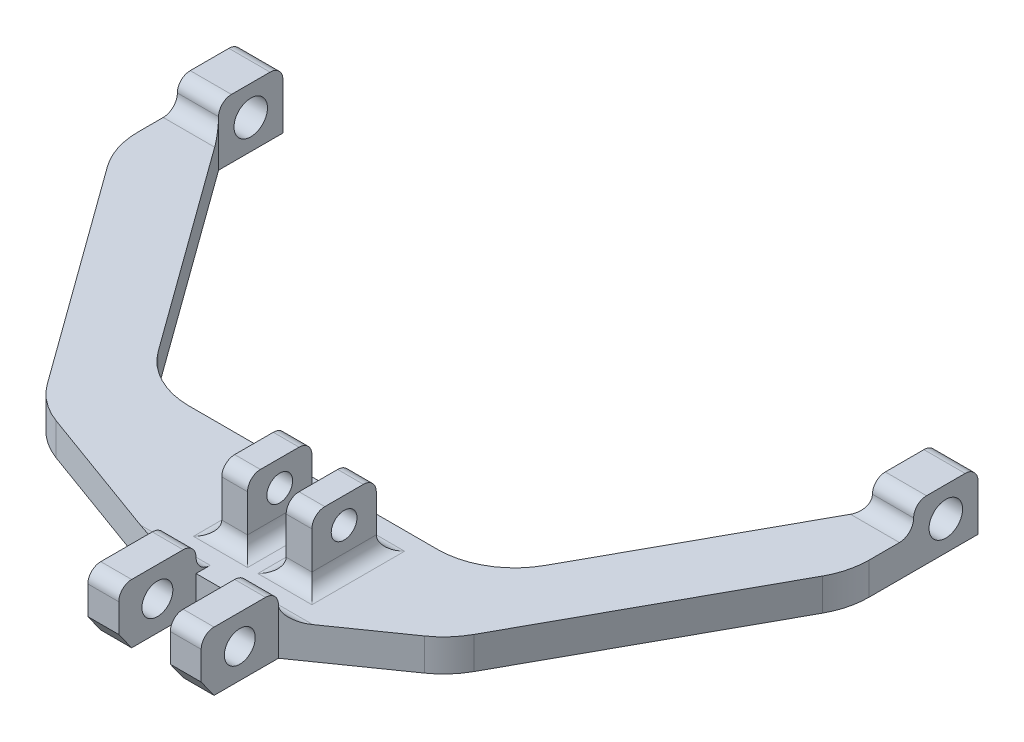
from build123d import *

# Parameters (mm, degrees)
BOSS_EXTRUDE1_DEPTH = 12.5
SKETCH5_W           = 10
SKETCH5_H           = 25
BOSS_EXTRUDE2_DEPTH = 25
SKETCH7_W           = 12
SKETCH7_H           = 30
BOSS_EXTRUDE4_DEPTH = 10.5
SKETCH8_R           = 6
CUT_EXTRUDE1_DEPTH  = 258.475083954
SKETCH11_W          = 16
SKETCH11_H          = 25
BOSS_EXTRUDE6_DEPTH = 10.5
SKETCH12_R          = 6.5
CUT_EXTRUDE3_DEPTH  = 356.26387941
SKETCH13_R          = 5
CUT_EXTRUDE4_DEPTH  = 261.08353454
FILLET2_R           = 30
FILLET3_R           = 5
FILLET4_R           = 5.5
CHAMFER1_SIZE       = 5
CHAMFER1_SIZE2      = 7


with BuildPart() as part:
    # Sketch2 → Boss-Extrude1 (new body)
    with BuildSketch(Plane(origin=(0, 0, 0), x_dir=(1, 0, 0), z_dir=(0, 1, 0))):
        Polygon((72.577488302, -150.138388534), (147.752897965, -177.5), (147.752897965, -207.5), (159.752897965, -207.5), (159.752897965, -177.5), (169.752897965, -177.5), (179.752897965, -177.5), (179.752897965, -207.5), (191.752897965, -207.5), (191.752897965, -177.5), (230.829328841, -150.138388534), (285.919436229, -50), (285.919436229, 0), (269.919436229, 0), (269.919436229, -25), (216.280811233, -122.5), (86.665258479, -122.5), (16, -25), (16, 0), (0, 0), (0, -50), align=None)
    extrude(amount=BOSS_EXTRUDE1_DEPTH)

    # Sketch5 → Boss-Extrude2 (add)
    with BuildSketch(Plane(origin=(0, 12.5, 0), x_dir=(1, 0, 0), z_dir=(0, 1, 0))):
        with Locations((157.252897965, -147.5)):
            Rectangle(SKETCH5_W, SKETCH5_H)
        with Locations((182.252897965, -147.5)):
            Rectangle(SKETCH5_W, SKETCH5_H)
    extrude(amount=BOSS_EXTRUDE2_DEPTH)

    # Sketch7 → Boss-Extrude4 (add)
    with BuildSketch(Plane(origin=(0, 12.5, 0), x_dir=(1, 0, 0), z_dir=(0, 1, 0))):
        with Locations((153.752897965, -192.5)):
            Rectangle(SKETCH7_W, SKETCH7_H)
        with Locations((185.752897965, -192.5)):
            Rectangle(SKETCH7_W, SKETCH7_H)
    extrude(amount=BOSS_EXTRUDE4_DEPTH)

    # Sketch8 → Cut-Extrude1 (cut, through all)
    with BuildSketch(Plane.ZY.offset(-147.752897965)):
        with Locations((192.5, 11.5)):
            Circle(SKETCH8_R)
    extrude(amount=-CUT_EXTRUDE1_DEPTH, mode=Mode.SUBTRACT)

    # Sketch11 → Boss-Extrude6 (add)
    with BuildSketch(Plane(origin=(0, 12.5, 0), x_dir=(1, 0, 0), z_dir=(0, 1, 0))):
        with Locations((8, -12.5)):
            Rectangle(SKETCH11_W, SKETCH11_H)
        with Locations((277.919436229, -12.5)):
            Rectangle(SKETCH11_W, SKETCH11_H)
    extrude(amount=BOSS_EXTRUDE6_DEPTH)

    # Sketch12 → Cut-Extrude3 (cut, through all)
    with BuildSketch(Plane.ZY):
        with Locations((12.5, 11.5)):
            Circle(SKETCH12_R)
    extrude(amount=-CUT_EXTRUDE3_DEPTH, mode=Mode.SUBTRACT)

    # Sketch13 → Cut-Extrude4 (cut, through all)
    with BuildSketch(Plane.ZY.offset(-152.252897965)):
        with Locations((147.5, 27.5)):
            Circle(SKETCH13_R)
    extrude(amount=-CUT_EXTRUDE4_DEPTH, mode=Mode.SUBTRACT)

    # Fillet2
    fillet2_edges = [part.edges().sort_by_distance(p)[0] for p in [
        (0, 6.25, 50),
        (86.665258479, 6.25, 122.5),
        (216.280811233, 6.25, 122.5),
        (285.919436229, 6.25, 50),
        (230.829328841, 6.25, 150.138388534),
        (72.577488302, 6.25, 150.138388534),
    ]]
    fillet(fillet2_edges, radius=FILLET2_R)

    # Fillet3
    fillet3_edges = [part.edges().sort_by_distance(p)[0] for p in [
        (185.752897965, 23, 207.5),
        (185.752897965, 23, 177.5),
        (8, 23, 25),
        (8, 23, 0),
        (277.919436229, 23, 25),
        (277.919436229, 23, 0),
        (157.252897965, 37.5, 160),
        (157.252897965, 37.5, 135),
        (182.252897965, 37.5, 160),
        (182.252897965, 37.5, 135),
        (153.752897965, 23, 207.5),
        (153.752897965, 23, 177.5),
    ]]
    fillet(fillet3_edges, radius=FILLET3_R)

    # Fillet4
    fillet4_edges = [part.edges().sort_by_distance(p)[0] for p in [
        (153.752897965, 12.5, 177.5),
        (185.752897965, 12.5, 177.5),
        (182.252897965, 12.5, 135),
        (157.252897965, 12.5, 135),
        (182.252897965, 12.5, 160),
        (157.252897965, 12.5, 160),
        (8, 12.5, 25),
        (277.919436229, 12.5, 25),
        (152.252897965, 12.5, 147.5),
        (187.252897965, 12.5, 147.5),
        (177.252897965, 12.5, 147.5),
        (162.252897965, 12.5, 147.5),
    ]]
    fillet(fillet4_edges, radius=FILLET4_R - 0.0001)  # a hair under: the kernel refuses the full size

    # Chamfer1
    chamfer1_edges = [part.edges().sort_by_distance(p)[0] for p in [
        (185.752897965, 0, 207.5),
        (153.752897965, 0, 207.5),
    ]]
    chamfer1_side = [part.faces().sort_by_distance(p)[0] for p in [
        (115.691812184, 0, 162.071200665),
    ]]
    chamfer(chamfer1_edges, length=CHAMFER1_SIZE, length2=CHAMFER1_SIZE2, reference=chamfer1_side[0])


solid = part.part
